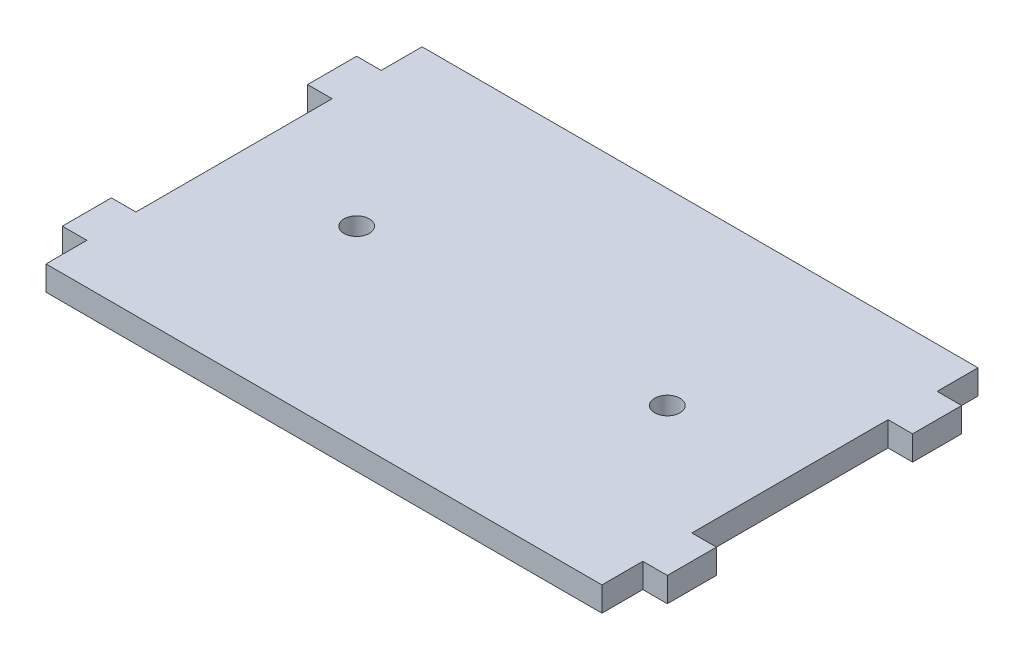
from build123d import *

# Parameters (mm, degrees)
SKETCH1_R           = 1.55
BOSS_EXTRUDE1_DEPTH = 3


with BuildPart() as part:
    # Sketch1 → Boss-Extrude1 (new body)
    with BuildSketch(Plane(origin=(0, 0, 0), x_dir=(1, 0, 0), z_dir=(0, 1, 0))):
        Polygon((-34, 23), (34, 23), (34, 18), (37, 18), (37, 12), (34, 12), (34, -12), (37, -12), (37, -18), (34, -18), (34, -23), (-34, -23), (-34, -18), (-37, -18), (-37, -12), (-34, -12), (-34, 12), (-37, 12), (-37, 18), (-34, 18), align=None)
        with Locations((19, 0)):
            Circle(SKETCH1_R, mode=Mode.SUBTRACT)
        with Locations((-19, 0)):
            Circle(SKETCH1_R, mode=Mode.SUBTRACT)
    extrude(amount=BOSS_EXTRUDE1_DEPTH)


solid = part.part
